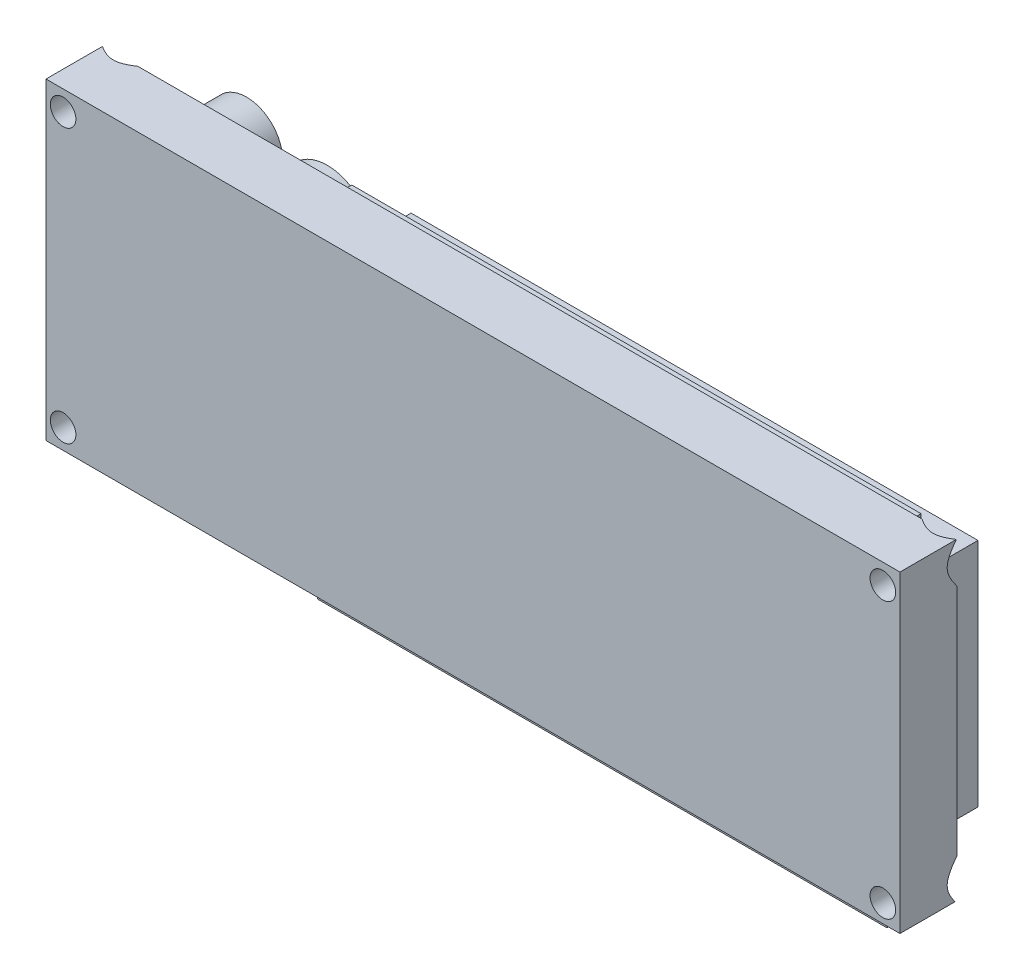
from build123d import *

# Parameters (mm, degrees)
SKETCH1_W                                           = 150
SKETCH1_H                                           = 55
BOSS_EXTRUDE1_DEPTH                                 = 10
CSK_FOR_M4_COUNTERSUNK_FLAT_HEAD_SCREW1_D           = 4.5
CSK_FOR_M4_COUNTERSUNK_FLAT_HEAD_SCREW1_CSINK_D     = 9.4
CSK_FOR_M4_COUNTERSUNK_FLAT_HEAD_SCREW1_CSINK_ANGLE = 90
SKETCH4_W                                           = 100
SKETCH4_H                                           = 60
BOSS_EXTRUDE2_DEPTH                                 = 6
SKETCH5_W                                           = 99.587167191
SKETCH5_H                                           = 40.554359572
BOSS_EXTRUDE3_DEPTH                                 = 10
SKETCH6_R                                           = 6.325350673
BOSS_EXTRUDE4_DEPTH                                 = 10
SKETCH7_R                                           = 6.761038659
SKETCH7_W                                           = 5.613398263
SKETCH7_H                                           = 5.940244602
BOSS_EXTRUDE5_DEPTH                                 = 5
SKETCH8_R                                           = 7.825257062
BOSS_EXTRUDE6_DEPTH                                 = 20


with BuildPart() as part:
    # Sketch1 → Boss-Extrude1 (new body)
    with BuildSketch(Plane.XY):
        Rectangle(SKETCH1_W, SKETCH1_H)
    extrude(amount=BOSS_EXTRUDE1_DEPTH)

    # CSK for M4 Countersunk Flat Head Screw1 (through all)
    with Locations(Plane(origin=(0, 0, 0), x_dir=(-1, 0, 0), z_dir=(0, 0, -1))):
        with Locations((-72, 24), (-72, -24.31977753), (72, -24), (72, 24)):
            CounterSinkHole(CSK_FOR_M4_COUNTERSUNK_FLAT_HEAD_SCREW1_D / 2, CSK_FOR_M4_COUNTERSUNK_FLAT_HEAD_SCREW1_CSINK_D / 2, counter_sink_angle=CSK_FOR_M4_COUNTERSUNK_FLAT_HEAD_SCREW1_CSINK_ANGLE)

    # Sketch4 → Boss-Extrude2 (add)
    with BuildSketch(Plane(origin=(0, 0, 0), x_dir=(-1, 0, 0), z_dir=(0, 0, -1))):
        with Locations((-12.709987385, -7.767861044)):
            Rectangle(SKETCH4_W, SKETCH4_H)
    extrude(amount=BOSS_EXTRUDE2_DEPTH)

    # Sketch5 → Boss-Extrude3 (add)
    with BuildSketch(Plane(origin=(0, 0, -6), x_dir=(-1, 0, 0), z_dir=(0, 0, -1))):
        with Locations((-12.91640379, -7.112004415)):
            Rectangle(SKETCH5_W, SKETCH5_H)
    extrude(amount=BOSS_EXTRUDE3_DEPTH)

    # Sketch6 → Boss-Extrude4 (add)
    with BuildSketch(Plane(origin=(0, 0, 0), x_dir=(-1, 0, 0), z_dir=(0, 0, -1))):
        with Locations((59.771620242, 16.04141059)):
            Circle(SKETCH6_R)
    extrude(amount=BOSS_EXTRUDE4_DEPTH)

    # Sketch7 → Boss-Extrude5 (add)
    with BuildSketch(Plane(origin=(0, 0, 0), x_dir=(-1, 0, 0), z_dir=(0, 0, -1))):
        with Locations((60.574566505, -3.736064786)):
            Circle(SKETCH7_R)
        with Locations((60.574566506, -19.28347932)):
            Rectangle(SKETCH7_W, SKETCH7_H)
    extrude(amount=BOSS_EXTRUDE5_DEPTH)

    # Sketch8 → Boss-Extrude6 (add)
    with BuildSketch(Plane(origin=(0, 0, -5), x_dir=(-1, 0, 0), z_dir=(0, 0, -1))):
        with Locations((60.574566505, -3.736064786)):
            Circle(SKETCH8_R)
    extrude(amount=BOSS_EXTRUDE6_DEPTH)


solid = part.part
